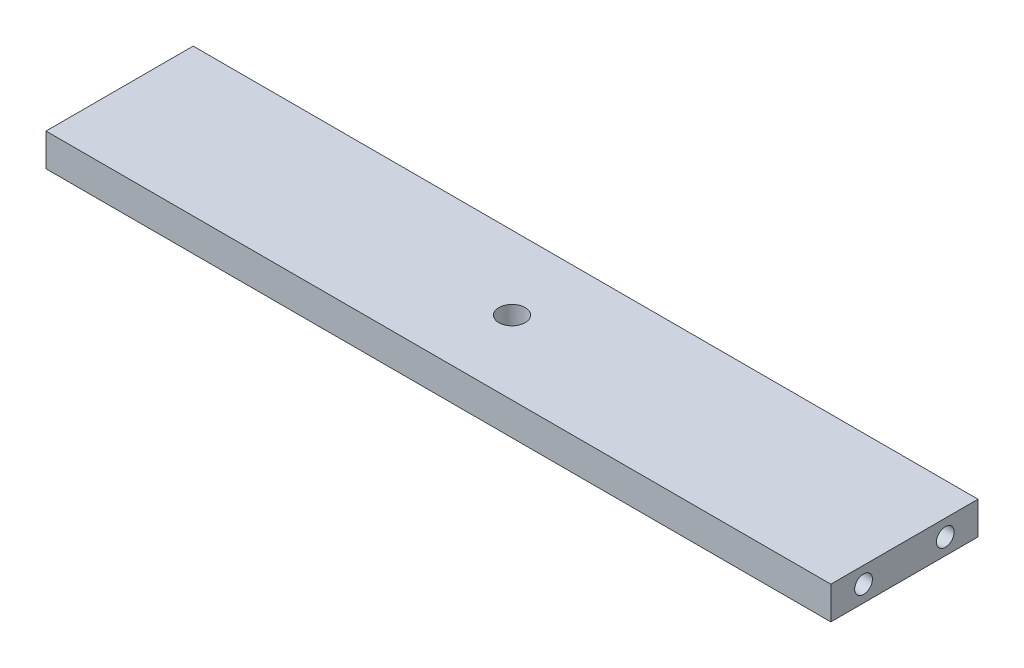
from build123d import *

# Parameters (mm, degrees)
SKETCH2_W                      = 152.4
SKETCH2_H                      = 28.575
BOSS_EXTRUDE1_DEPTH            = 6.35
F_1_4_20_TAPPED_HOLE1_D        = 5.1054
F_8_32_TAPPED_HOLE1_AT_2_COUNT = 2
F_8_32_TAPPED_HOLE1_AT_2_PITCH = 15.875


with BuildPart() as part:
    # Sketch2 → Boss-Extrude1 (new body)
    with BuildSketch(Plane(origin=(0, 0, 0), x_dir=(1, 0, 0), z_dir=(0, 1, 0))):
        Rectangle(SKETCH2_W, SKETCH2_H)
    extrude(amount=BOSS_EXTRUDE1_DEPTH)

    # 1/4-20 Tapped Hole1 (through all)
    with Locations(Plane(origin=(0, 0, 0), x_dir=(-1, 0, 0), z_dir=(0, -1, 0))):
        with Locations((0, 0)):
            Hole(F_1_4_20_TAPPED_HOLE1_D / 2)

    # Sketch7 → #8-32 Tapped Hole1 (revolve, cut)
    with BuildSketch(Plane(origin=(-76.2, 3.175, -7.9375), x_dir=(0, 0, 1), z_dir=(0, 1, 0))):
        Polygon((0, 0), (0, 7.387806461), (1.7272, 6.35), (1.7272, 0), align=None)
    f_8_32_tapped_hole1 = revolve(axis=Axis((-82.55, 3.175, -7.9375), (1, 0, 0)), mode=Mode.SUBTRACT)

    # #8-32 Tapped Hole1 at 2: #8-32 Tapped Hole1 ×2
    with Locations(*[(0, 0, i * F_8_32_TAPPED_HOLE1_AT_2_PITCH) for i in range(1, F_8_32_TAPPED_HOLE1_AT_2_COUNT)]):
        add(f_8_32_tapped_hole1, mode=Mode.SUBTRACT)

    # Mirror1: #8-32 Tapped Hole1 across plane
    add(f_8_32_tapped_hole1.mirror(Plane(origin=(0, 0, 0), x_dir=(0, 0, 1), z_dir=(1, 0, 0))), mode=Mode.SUBTRACT)

    # Mirror1 copy 1 sketch → Mirror1 copy 1 (revolve, cut)
    with BuildSketch(Plane(origin=(76.2, 3.175, 7.9375), x_dir=(0, 0, 1), z_dir=(0, 1, 0))):
        Polygon((0, 0), (0, -7.387806461), (1.7272, -6.35), (1.7272, 0), align=None)
    revolve(axis=Axis((82.55, 3.175, 7.9375), (1, 0, 0)), mode=Mode.SUBTRACT)


solid = part.part
